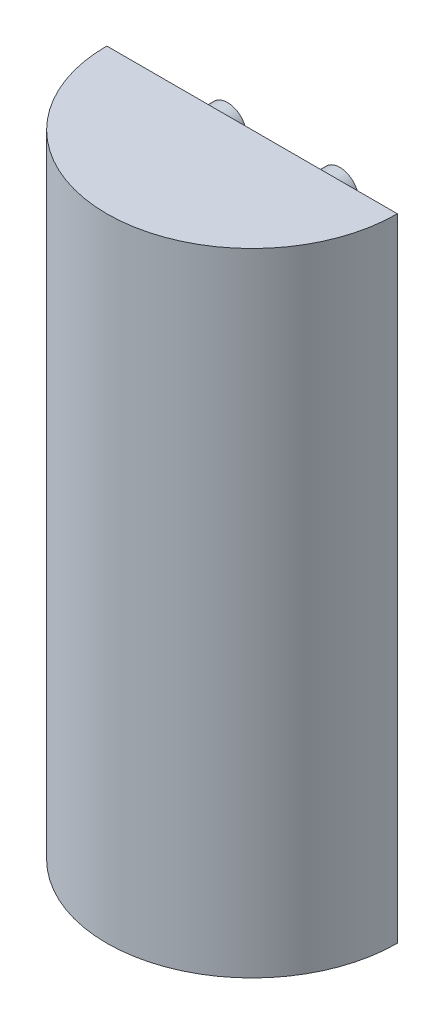
from build123d import *

# Parameters (mm, degrees)
EXTRUDE_1_DEPTH = 100
SKETCH_2_R      = 3
SKETCH_2_R_2    = 0.9
EXTRUDE_2_DEPTH = 5


with BuildPart() as part:
    # Эскиз1 → Бобышка-Вытянуть1 (new body)
    with BuildSketch(Plane(origin=(0, 0, 0), x_dir=(1, 0, 0), z_dir=(0, 1, 0))):
        with BuildLine():
            Line((-23, 0), (23, 0))
            ThreePointArc((23, 0), (0, -23), (-23, 0))
        make_face()
    extrude(amount=EXTRUDE_1_DEPTH)

    # Эскиз2 → Бобышка-Вытянуть2 (add)
    # profile 1 of 4: a face of its own
    with BuildSketch(Plane(origin=(0, 0, 0), x_dir=(-1, 0, 0), z_dir=(0, 0, -1))):
        with Locations((-8.89, 93.815)):
            Circle(SKETCH_2_R)
        with Locations((-8.89, 93.815)):
            Circle(SKETCH_2_R_2, mode=Mode.SUBTRACT)
    # profile 2 of 4: a face of its own
    with BuildSketch(Plane(origin=(0, 0, 0), x_dir=(-1, 0, 0), z_dir=(0, 0, -1))):
        with Locations((8.89, 93.815)):
            Circle(SKETCH_2_R)
        with Locations((8.89, 93.815)):
            Circle(SKETCH_2_R_2, mode=Mode.SUBTRACT)
    # profile 3 of 4: a face of its own
    with BuildSketch(Plane(origin=(0, 0, 0), x_dir=(-1, 0, 0), z_dir=(0, 0, -1))):
        with Locations((-8.89, 6.185)):
            Circle(SKETCH_2_R)
        with Locations((-8.89, 6.185)):
            Circle(SKETCH_2_R_2, mode=Mode.SUBTRACT)
    # profile 4 of 4: a face of its own
    with BuildSketch(Plane(origin=(0, 0, 0), x_dir=(-1, 0, 0), z_dir=(0, 0, -1))):
        with Locations((8.89, 6.185)):
            Circle(SKETCH_2_R)
        with Locations((8.89, 6.185)):
            Circle(SKETCH_2_R_2, mode=Mode.SUBTRACT)
    extrude(amount=EXTRUDE_2_DEPTH)


solid = part.part
